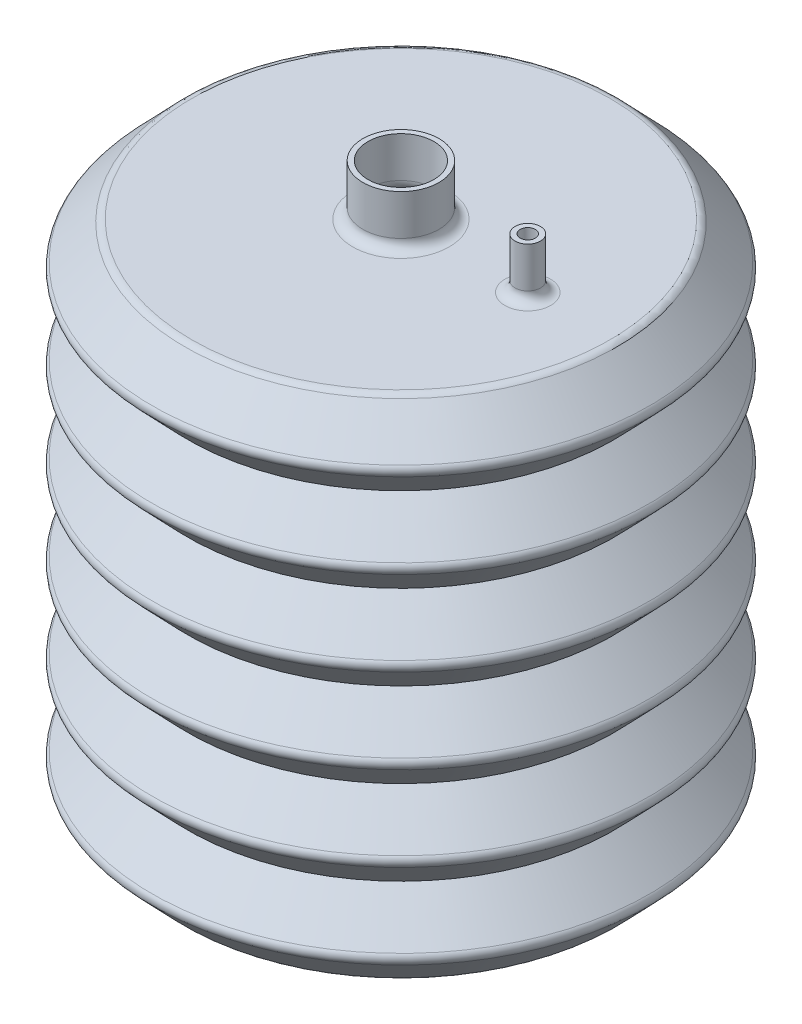
from build123d import *

# Parameters (mm, degrees)
ESBO_O2_R                = 2.5
RESSALTO_EXTRUS_O1_DEPTH = 10
FILETE1_R                = 2
CASCA2_T                 = -1


with BuildPart() as part:
    # Esboço1 → Revolução1 (revolve)
    with BuildSketch(Plane(origin=(0, 0, 0), x_dir=(0, 0, -1), z_dir=(1, 0, 0))):
        with BuildLine():
            Line((0, 0), (41.147564248, 0))
            ThreePointArc((41.147564248, 0), (41.931743018, 0.160145751), (42.59033889, 0.614936344))
            Line((42.59033889, 0.614936344), (49.040799334, 7.334165973))
            ThreePointArc((49.040799334, 7.334165973), (49.442774642, 8.333333333), (49.040799334, 9.332500694))
            Line((49.040799334, 9.332500694), (42, 16.666666667))
            Line((42, 16.666666667), (49.040799334, 24.000832639))
            ThreePointArc((49.040799334, 24.000832639), (49.442774642, 25), (49.040799334, 25.999167361))
            Line((49.040799334, 25.999167361), (42, 33.333333333))
            Line((42, 33.333333333), (49.040799334, 40.667499306))
            ThreePointArc((49.040799334, 40.667499306), (49.442774642, 41.666666667), (49.040799334, 42.665834027))
            Line((49.040799334, 42.665834027), (42, 50))
            Line((42, 50), (49.040799334, 57.334165973))
            ThreePointArc((49.040799334, 57.334165973), (49.442774642, 58.333333333), (49.040799334, 59.332500694))
            Line((49.040799334, 59.332500694), (42, 66.666666667))
            Line((42, 66.666666667), (49.040799334, 74.000832639))
            ThreePointArc((49.040799334, 74.000832639), (49.442774642, 75), (49.040799334, 75.999167361))
            Line((49.040799334, 75.999167361), (42, 83.333333333))
            Line((42, 83.333333333), (49.040799334, 90.667499306))
            ThreePointArc((49.040799334, 90.667499306), (49.442774642, 91.666666667), (49.040799334, 92.665834027))
            Line((49.040799334, 92.665834027), (42.543068757, 99.434303378))
            ThreePointArc((42.543068757, 99.434303378), (41.937208551, 99.85267758), (41.21582123, 100))
            Line((41.21582123, 100), (9.5, 100))
            ThreePointArc((9.5, 100), (8.085786438, 100.585786438), (7.5, 102))
            Line((7.5, 102), (7.5, 110))
            Line((7.5, 110), (0, 110))
            Line((0, 110), (0, 100))
            Line((0, 100), (0, 0))
        make_face()
    revolve(axis=Axis((0, 0, 0), (0, 1, 0)))

    # Esboço2 → Ressalto-extrusão1 (add)
    with BuildSketch(Plane(origin=(0, 100, 0), x_dir=(1, 0, 0), z_dir=(0, 1, 0))):
        with Locations((25, 0)):
            Circle(ESBO_O2_R)
    extrude(amount=RESSALTO_EXTRUS_O1_DEPTH)

    # Filete1
    filete1_edges = [part.edges().sort_by_distance(p)[0] for p in [
        (22.5, 100, 0),
    ]]
    fillet(filete1_edges, radius=FILETE1_R)

    # Casca2
    casca2_openings = [part.faces().sort_by_distance(p)[0] for p in [
        (25, 110, 0),
        (0, 110, 0),
    ]]
    offset(amount=CASCA2_T, openings=casca2_openings, kind=Kind.INTERSECTION)


solid = part.part
